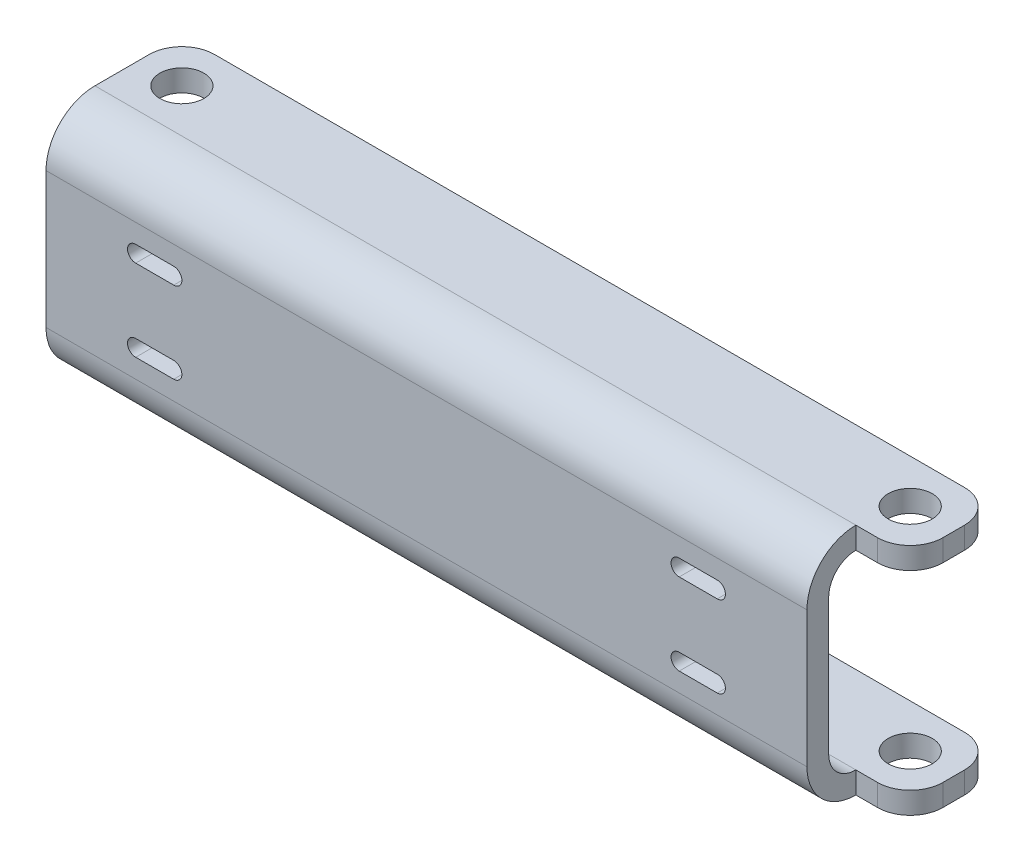
from build123d import *

# Parameters (mm, degrees)
EXTRUSION_DEPTH  = 150
SKETCH_4_R       = 4.05
HOLES_DEPTH      = 159.031642401
SKETCH_5_W       = 10
SKETCH_5_H       = 9
SLOT_DEPTH       = 159.031642401
FILLET_2_R       = 6
MORE_HOLES_DEPTH = 4


# Sheet-metal steps are written as plain solids
with BuildPart() as part:
    # Sketch 1 → Extrusion (new body)
    with BuildSketch(Plane(origin=(0, 0, 0), x_dir=(0, 0, -1), z_dir=(1, 0, 0))):
        with BuildLine():
            Line((25, -43), (9, -43))
            ThreePointArc((9, -43), (2.636038969, -40.363961031), (0, -34))
            Line((0, -34), (0, -9))
            ThreePointArc((0, -9), (2.636038969, -2.636038969), (9, 0))
            Line((9, 0), (25, 0))
            Line((25, 0), (25, -4))
            Line((25, -4), (9, -4))
            ThreePointArc((9, -4), (5.464466094, -5.464466094), (4, -9))
            Line((4, -9), (4, -34))
            ThreePointArc((4, -34), (5.464466094, -37.535533906), (9, -39))
            Line((9, -39), (25, -39))
            Line((25, -39), (25, -43))
        make_face()
    extrude(amount=EXTRUSION_DEPTH)

    # Эскиз4 → Holes (cut, through all)
    with BuildSketch(Plane(origin=(0, 0, 0), x_dir=(1, 0, 0), z_dir=(0, 1, 0))):
        with Locations(Location((8, 17, 0), (0, 0, 270))):
            Circle(SKETCH_4_R)
        with Locations(Location((142, 17, 0), (0, 0, 270))):
            Circle(SKETCH_4_R)
    extrude(amount=-HOLES_DEPTH, mode=Mode.SUBTRACT)

    # Эскиз5 → SLot (cut, through all)
    with BuildSketch(Plane.XZ.offset(43)):
        with Locations((145, -4.5)):
            Rectangle(SKETCH_5_W, SKETCH_5_H)
    extrude(amount=-SLOT_DEPTH, mode=Mode.SUBTRACT)

    # Fillet 2
    fillet_2_edges = [part.edges().sort_by_distance(p)[0] for p in [
        (0, -41, -25),
        (0, -2, -25),
        (150, -41, -25),
        (150, -2, -9),
        (150, -41, -9),
        (150, -2, -25),
    ]]
    fillet(fillet_2_edges, radius=FILLET_2_R)

    # Эскиз6 → More Holes (cut)
    with BuildSketch(Plane.XY):
        with BuildLine():
            Line((16.5, -12.5), (23.5, -12.5))
            ThreePointArc((23.5, -12.5), (25, -14), (23.5, -15.5))
            Line((23.5, -15.5), (16.5, -15.5))
            ThreePointArc((16.5, -15.5), (15, -14), (16.5, -12.5))
        make_face()
        with BuildLine():
            Line((123.5, -12.5), (116.5, -12.5))
            ThreePointArc((116.5, -12.5), (115, -14), (116.5, -15.5))
            Line((116.5, -15.5), (123.5, -15.5))
            ThreePointArc((123.5, -15.5), (125, -14), (123.5, -12.5))
        make_face()
        with BuildLine():
            Line((123.5, -30.5), (116.5, -30.5))
            ThreePointArc((116.5, -30.5), (115, -29), (116.5, -27.5))
            Line((116.5, -27.5), (123.5, -27.5))
            ThreePointArc((123.5, -27.5), (125, -29), (123.5, -30.5))
        make_face()
        with BuildLine():
            Line((16.5, -30.5), (23.5, -30.5))
            ThreePointArc((23.5, -30.5), (25, -29), (23.5, -27.5))
            Line((23.5, -27.5), (16.5, -27.5))
            ThreePointArc((16.5, -27.5), (15, -29), (16.5, -30.5))
        make_face()
    extrude(amount=-MORE_HOLES_DEPTH, mode=Mode.SUBTRACT)


solid = part.part
